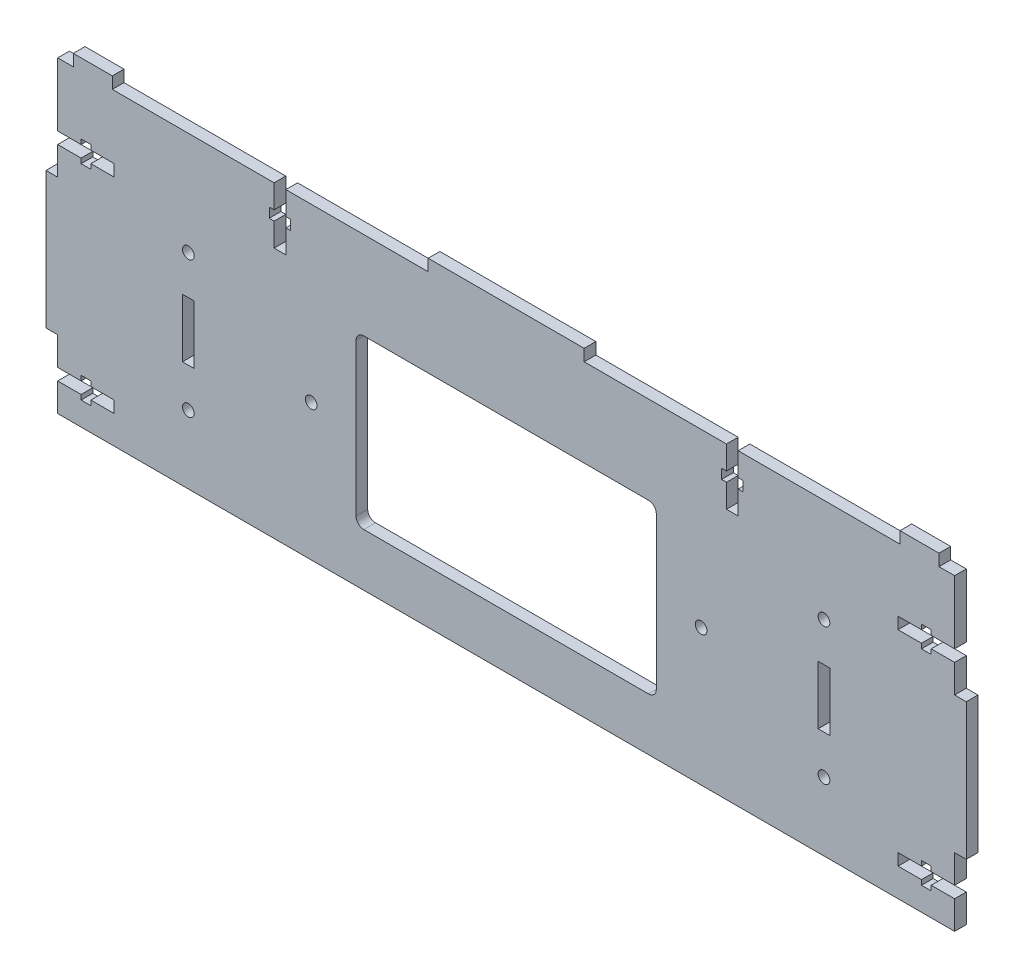
from build123d import *

# Parameters (mm, degrees)
SKETCH_1_W           = 230
SKETCH_1_H           = 79
EXTRUDE_1_DEPTH      = 3
EXTRUDE_2_DEPTH      = 3
EXTRUDE_2_DEPTH_BACK = 233
SKETCH_4_W           = 3
SKETCH_4_H           = 35
SKETCH_2_R           = 1.5
CUT_EXTRUDE_1_DEPTH  = 3
SKETCH_3_R           = 1.5
CUT_EXTRUDE_2_DEPTH  = 3
SKETCH_5_W           = 3
SKETCH_5_H           = 15
CUT_EXTRUDE_3_DEPTH  = 3
CUT_EXTRUDE_4_DEPTH  = 3
SKETCH_8_W           = 10
SKETCH_8_H           = 3
EXTRUDE_3_DEPTH      = 3
SKETCH_9_W           = 40
SKETCH_9_H           = 3
EXTRUDE_4_DEPTH      = 3
CUT_EXTRUDE_5_DEPTH  = 3
CUT_EXTRUDE_6_DEPTH  = 3


with BuildPart() as part:
    # Эскиз1 → Бобышка-Вытянуть1 (new body)
    with BuildSketch(Plane.XY):
        with Locations((115, 39.5)):
            Rectangle(SKETCH_1_W, SKETCH_1_H)
    extrude(amount=EXTRUDE_1_DEPTH)

    # Эскиз4 → Бобышка-Вытянуть2 (add, two sides: drawn at the far end of the back side and taken through both)
    with BuildSketch(Plane(origin=(230, 0, 0), x_dir=(0, 0, -1), z_dir=(1, 0, 0)).offset(-EXTRUDE_2_DEPTH_BACK)):
        with Locations((-1.5, 35)):
            Rectangle(SKETCH_4_W, SKETCH_4_H)
    extrude(amount=EXTRUDE_2_DEPTH + EXTRUDE_2_DEPTH_BACK)

    # Эскиз2 → Вырез-Вытянуть1 (cut)
    with BuildSketch(Plane.XY.offset(3)):
        with Locations((65, 35)):
            Circle(SKETCH_2_R)
        with Locations((165, 35)):
            Circle(SKETCH_2_R)
    extrude(amount=-CUT_EXTRUDE_1_DEPTH, mode=Mode.SUBTRACT)

    # Эскиз3 → Вырез-Вытянуть2 (cut)
    with BuildSketch(Plane.XY.offset(3)):
        with Locations((33.5, 52.5)):
            Circle(SKETCH_3_R)
        with Locations((196.5, 52.5)):
            Circle(SKETCH_3_R)
        with Locations((196.5, 17.5)):
            Circle(SKETCH_3_R)
        with Locations((33.5, 17.5)):
            Circle(SKETCH_3_R)
    extrude(amount=-CUT_EXTRUDE_2_DEPTH, mode=Mode.SUBTRACT)

    # Эскиз5 → Вырез-Вытянуть3 (cut)
    with BuildSketch(Plane.XY.offset(3)):
        with Locations((33.5, 35)):
            Rectangle(SKETCH_5_W, SKETCH_5_H)
        with Locations((196.5, 35)):
            Rectangle(SKETCH_5_W, SKETCH_5_H)
    extrude(amount=-CUT_EXTRUDE_3_DEPTH, mode=Mode.SUBTRACT)

    # Эскиз6 → Вырез-Вытянуть4 (cut)
    with BuildSketch(Plane.XY.offset(3)):
        Polygon((0, 10.25), (6, 10.25), (6, 11.5), (8.5, 11.5), (8.5, 10.25), (14.5, 10.25), (14.5, 7.25), (8.5, 7.25), (8.5, 6), (6, 6), (6, 7.25), (0, 7.25), align=None)
        Polygon((230, 7.25), (230, 10.25), (224, 10.25), (224, 11.5), (221.5, 11.5), (221.5, 10.25), (215.5, 10.25), (215.5, 7.25), (221.5, 7.25), (221.5, 6), (224, 6), (224, 7.25), align=None)
        Polygon((230, 59.75), (224, 59.75), (224, 58.5), (221.5, 58.5), (221.5, 59.75), (215.5, 59.75), (215.5, 62.75), (221.5, 62.75), (221.5, 64), (224, 64), (224, 62.75), (230, 62.75), align=None)
        Polygon((0, 62.75), (0, 59.75), (6, 59.75), (6, 58.5), (8.5, 58.5), (8.5, 59.75), (14.5, 59.75), (14.5, 62.75), (8.5, 62.75), (8.5, 64), (6, 64), (6, 62.75), align=None)
    extrude(amount=-CUT_EXTRUDE_4_DEPTH, mode=Mode.SUBTRACT)

    # Эскиз8 → Бобышка-Вытянуть3 (add)
    with BuildSketch(Plane(origin=(0, 79, 0), x_dir=(1, 0, 0), z_dir=(0, 1, 0))):
        with Locations((221, -1.5)):
            Rectangle(SKETCH_8_W, SKETCH_8_H)
        with Locations((9, -1.5)):
            Rectangle(SKETCH_8_W, SKETCH_8_H)
    extrude(amount=EXTRUDE_3_DEPTH)

    # Эскиз9 → Бобышка-Вытянуть4 (add)
    with BuildSketch(Plane(origin=(0, 79, 0), x_dir=(1, 0, 0), z_dir=(0, 1, 0))):
        with Locations((115, -1.5)):
            Rectangle(SKETCH_9_W, SKETCH_9_H)
    extrude(amount=EXTRUDE_4_DEPTH)

    # Эскиз10 → Вырез-Вытянуть5 (cut)
    with BuildSketch(Plane.XY.offset(3)):
        Polygon((55.5, 79), (55.5, 73), (54.25, 73), (54.25, 70.5), (55.5, 70.5), (55.5, 64.5), (58.5, 64.5), (58.5, 70.5), (59.75, 70.5), (59.75, 73), (58.5, 73), (58.5, 79), align=None)
        Polygon((171.5, 79), (174.5, 79), (174.5, 73), (175.75, 73), (175.75, 70.5), (174.5, 70.5), (174.5, 64.5), (171.5, 64.5), (171.5, 70.5), (170.25, 70.5), (170.25, 73), (171.5, 73), align=None)
    extrude(amount=-CUT_EXTRUDE_5_DEPTH, mode=Mode.SUBTRACT)

    # Эскиз11 → Вырез-Вытянуть6 (cut)
    with BuildSketch(Plane.XY.offset(3)):
        with BuildLine():
            Line((78.5, 56.5), (151.5, 56.5))
            ThreePointArc((151.5, 56.5), (152.914213562, 55.914213562), (153.5, 54.5))
            Line((153.5, 54.5), (153.5, 15.5))
            ThreePointArc((153.5, 15.5), (152.914213562, 14.085786438), (151.5, 13.5))
            Line((151.5, 13.5), (78.5, 13.5))
            ThreePointArc((78.5, 13.5), (77.085786438, 14.085786438), (76.5, 15.5))
            Line((76.5, 15.5), (76.5, 54.5))
            ThreePointArc((76.5, 54.5), (77.085786438, 55.914213562), (78.5, 56.5))
        make_face()
    extrude(amount=-CUT_EXTRUDE_6_DEPTH, mode=Mode.SUBTRACT)


solid = part.part
